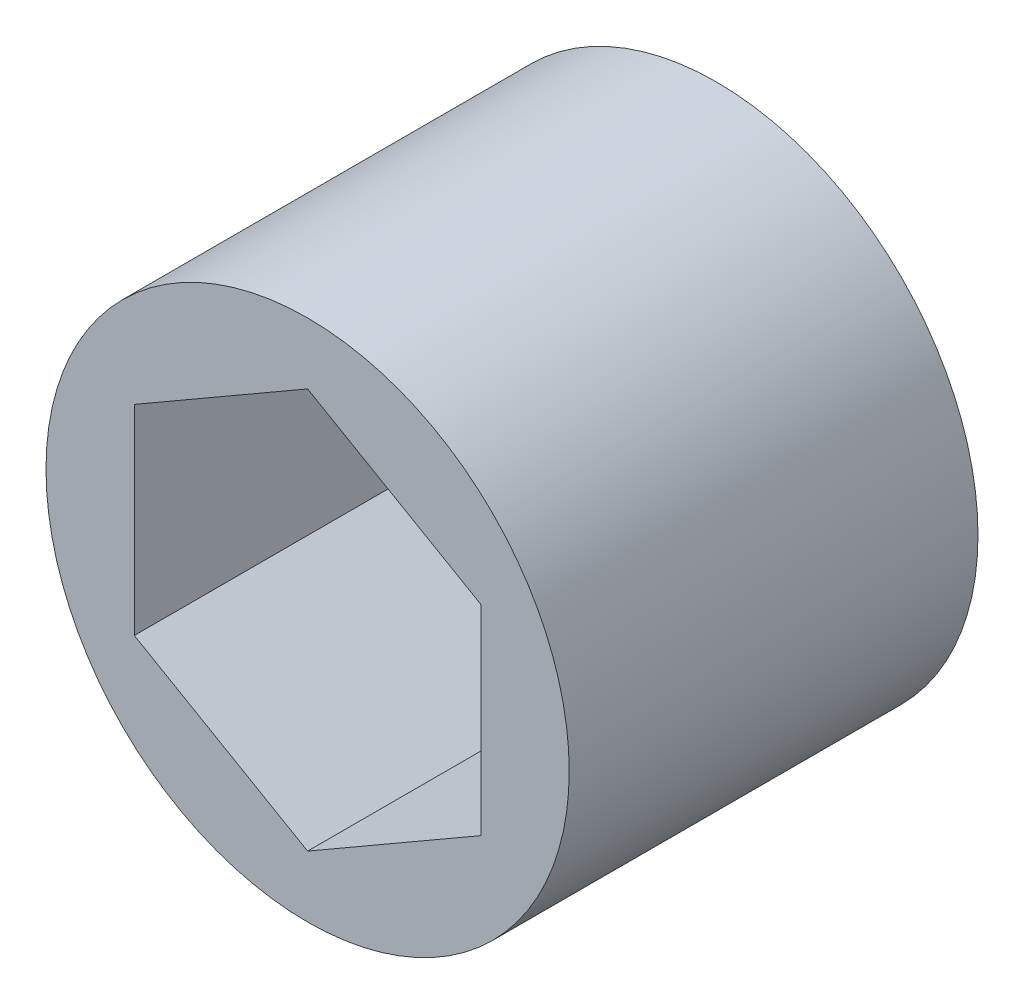
from build123d import *

# Parameters (mm, degrees)
SKETCH3_R           = 10.16
BOSS_EXTRUDE1_DEPTH = 7.9375


with BuildPart() as part:
    # Sketch3 → Boss-Extrude1 (new, symmetric)
    with BuildSketch(Plane.XY):
        Circle(SKETCH3_R)
        Polygon((0, 7.772289324), (-6.731, 3.886144662), (-6.731, -3.886144662), (0, -7.772289324), (6.731, -3.886144662), (6.731, 3.886144662), align=None, mode=Mode.SUBTRACT)
    extrude(amount=BOSS_EXTRUDE1_DEPTH, both=True)


solid = part.part
